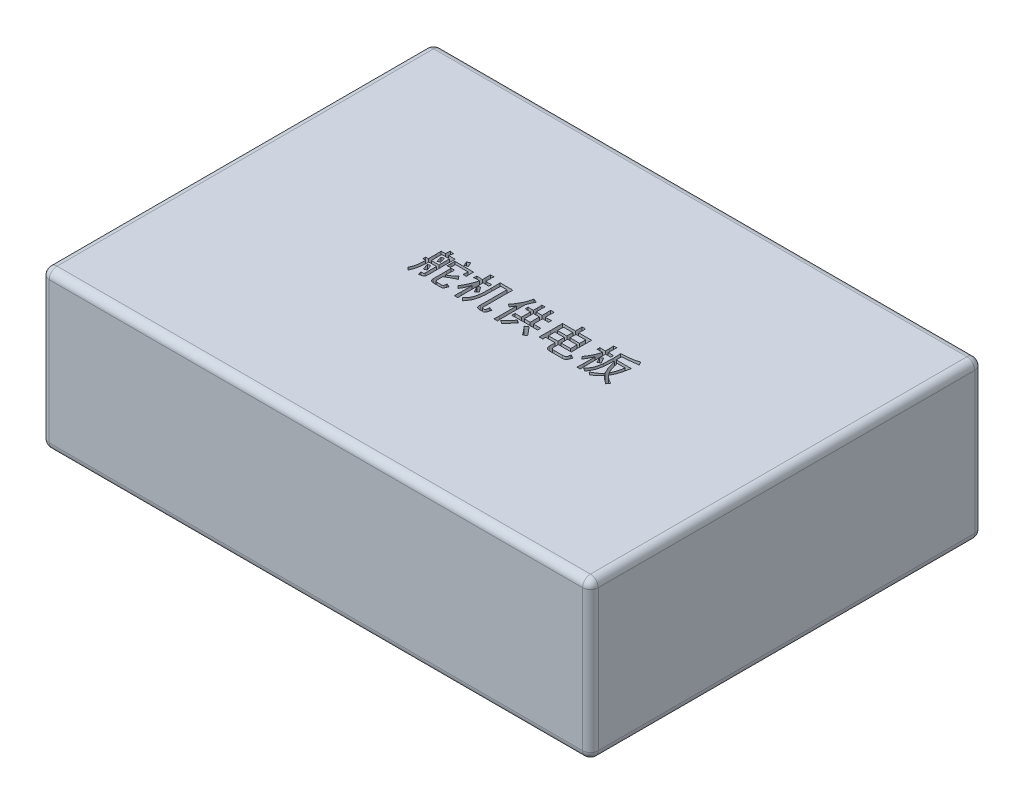
from build123d import *

# Parameters (mm, degrees)
SKETCH_1_W          = 70
SKETCH_1_H          = 50
EXTRUDE_1_DEPTH     = 20
SKETCH_2_W          = 0.982456141
SKETCH_2_H          = 1.330409356
SKETCH_2_W_2        = 0.757309941
SKETCH_2_H_2        = 1.166666667
SKETCH_2_W_3        = 1.228070175
SKETCH_2_H_3        = 0.81871345
SKETCH_2_W_4        = 1.187134503
SKETCH_2_H_4        = 0.757309942
CUT_EXTRUDE_1_DEPTH = 2
FILLET_1_R          = 1


with BuildPart() as part:
    # 草图1 → 凸台-拉伸1 (new body)
    with BuildSketch(Plane(origin=(0, 0, 0), x_dir=(1, 0, 0), z_dir=(0, 1, 0))):
        Rectangle(SKETCH_1_W, SKETCH_1_H)
    extrude(amount=EXTRUDE_1_DEPTH)

    # 草图2 → 切除-拉伸1 (cut)
    # profile 1 of 15: a face of its own
    with BuildSketch(Plane(origin=(0, 20, 0), x_dir=(1, 0, 0), z_dir=(0, 1, 0))):
        with BuildLine():
            add(Edge.make_bspline(
                [(-10.091180796, 2.630830383), (-10.116509023, 2.549352299), (-10.166692378, 2.387918032), (-10.198322063, 2.221852365), (-10.213987814, 2.139602312)],
                knots=[0, 0, 0, 0, 1.009427368, 2, 2, 2, 2], degree=3))
            Line((-10.213987814, 2.139602312), (-9.374806527, 2.139602312))
            add(Edge.make_bspline(
                [(-9.374806527, 2.139602312), (-9.380681528, 2.023642055), (-9.392426642, 1.791817995), (-9.394325386, 1.559704393), (-9.395274364, 1.44369588)],
                knots=[0, 0, 0, 0, 1.000416063, 2, 2, 2, 2], degree=3))
            Line((-9.395274364, 1.44369588), (-9.395274364, -1.319462015))
            add(Edge.make_bspline(
                [(-9.395274364, -1.319462015), (-9.395479753, -1.343981891), (-9.395869913, -1.390560204), (-9.40106531, -1.456943952), (-9.410225057, -1.516170953), (-9.421782985, -1.568645944), (-9.437633649, -1.614078202), (-9.457400929, -1.652294079), (-9.480116935, -1.684313908), (-9.508299614, -1.710099406), (-9.543709064, -1.730557479), (-9.58670202, -1.751289052), (-9.639876589, -1.771228245), (-9.702886829, -1.791591983), (-9.775763303, -1.81189328), (-9.858455241, -1.832231036), (-9.950971765, -1.852678427), (-10.016102366, -1.8654162), (-10.050245124, -1.872093594)],
                knots=[0, 0, 0, 0, 1.192261739, 2.264837708, 3.234637038, 4.105058576, 4.874652043, 5.567196767, 6.19150862, 6.774285489, 7.408675279, 8.172655873, 9.094639486, 10.167215454, 11.392706019, 12.772661644, 14.308164957, 16, 16, 16, 16], degree=3))
            add(Edge.make_bspline(
                [(-10.050245124, -1.872093594), (-10.055131622, -1.839607602), (-10.065558579, -1.770288021), (-10.096814916, -1.662915484), (-10.138255675, -1.544606997), (-10.174419878, -1.464244562), (-10.193519978, -1.421801196)],
                knots=[0, 0, 0, 0, 0.83028686, 1.771690953, 2.823120079, 4, 4, 4, 4], degree=3))
            add(Edge.make_bspline(
                [(-10.193519978, -1.421801196), (-10.158664261, -1.42475731), (-10.094814571, -1.430172403), (-10.00708365, -1.435158972), (-9.936271876, -1.435757895), (-9.886953088, -1.434861707), (-9.854739953, -1.428468179), (-9.835196569, -1.416922045), (-9.819643454, -1.39959768), (-9.805247005, -1.378008106), (-9.796058442, -1.350028676), (-9.789543067, -1.317183396), (-9.784832653, -1.279159066), (-9.784395446, -1.252009408), (-9.784163252, -1.23759067)],
                knots=[0, 0, 0, 0, 2.276838966, 4.170778201, 5.716852393, 6.886417439, 7.377068686, 7.834037491, 8.334243345, 8.881697534, 9.511198957, 10.233730078, 11.061963073, 12, 12, 12, 12], degree=3))
            Line((-9.784163252, -1.23759067), (-9.784163252, 0.154222195))
            Line((-9.784163252, 0.154222195), (-10.766619393, 0.154222195))
            add(Edge.make_bspline(
                [(-10.766619393, 0.154222195), (-10.767019743, 0.088263387), (-10.767832972, -0.045718421), (-10.775827461, -0.249951662), (-10.788741901, -0.460490758), (-10.806531583, -0.67438661), (-10.829642388, -0.884955943), (-10.861320009, -1.086169058), (-10.901420861, -1.2743355), (-10.948130439, -1.450330815), (-11.002588488, -1.613353143), (-11.060176936, -1.765468456), (-11.124760099, -1.905561286), (-11.172949821, -1.993139109), (-11.196443954, -2.035836284)],
                knots=[0, 0, 0, 0, 1.052188393, 2.137305159, 3.26004622, 4.416994961, 5.561062578, 6.638658199, 7.664889657, 8.629032334, 9.541755406, 10.405664026, 11.222706841, 12, 12, 12, 12], degree=3))
            add(Edge.make_bspline(
                [(-11.196443954, -2.035836284), (-11.22332655, -2.006374746), (-11.275405761, -1.94929939), (-11.35790899, -1.872801613), (-11.439230857, -1.805108333), (-11.496287186, -1.767504534), (-11.523929334, -1.749286576)],
                knots=[0, 0, 0, 0, 1.095833255, 2.12293979, 3.090618405, 4, 4, 4, 4], degree=3))
            add(Edge.make_bspline(
                [(-11.523929334, -1.749286576), (-11.506526676, -1.719976149), (-11.469667896, -1.657896751), (-11.421395833, -1.554230657), (-11.373497004, -1.437137881), (-11.327890814, -1.306543369), (-11.284163698, -1.16407575), (-11.248571312, -1.009930677), (-11.217977492, -0.846094963), (-11.194961507, -0.671176875), (-11.176800039, -0.484330216), (-11.164192076, -0.283833589), (-11.156546171, -0.069468769), (-11.155861216, 0.078155964), (-11.155508282, 0.154222195)],
                knots=[0, 0, 0, 0, 0.625143458, 1.324052022, 2.095539542, 2.946088223, 3.861405889, 4.828605592, 5.84715547, 6.91863876, 8.064676218, 9.291293629, 10.604291555, 12, 12, 12, 12], degree=3))
            add(Edge.make_bspline(
                [(-11.155508282, 0.154222195), (-11.21190011, 0.153178998), (-11.328155616, 0.151028378), (-11.443874265, 0.139625874), (-11.503461498, 0.133754359)],
                knots=[0, 0, 0, 0, 0.970136036, 2, 2, 2, 2], degree=3))
            Line((-11.503461498, 0.133754359), (-11.503461498, 0.502175412))
            add(Edge.make_bspline(
                [(-11.503461498, 0.502175412), (-11.470628035, 0.498945323), (-11.40754807, 0.492739647), (-11.316769592, 0.48697766), (-11.233626296, 0.482827143), (-11.180781602, 0.482069787), (-11.155508282, 0.481707576)],
                knots=[0, 0, 0, 0, 1.135354998, 2.181254894, 3.13017326, 4, 4, 4, 4], degree=3))
            Line((-11.155508282, 0.481707576), (-11.155508282, 1.44369588))
            add(Edge.make_bspline(
                [(-11.155508282, 1.44369588), (-11.155859124, 1.499037036), (-11.156573698, 1.611752463), (-11.160584189, 1.783085075), (-11.166344382, 1.959753938), (-11.172728773, 2.078966342), (-11.175976118, 2.139602312)],
                knots=[0, 0, 0, 0, 0.953766709, 1.942572767, 2.953514133, 4, 4, 4, 4], degree=3))
            Line((-11.175976118, 2.139602312), (-10.623344539, 2.139602312))
            add(Edge.make_bspline(
                [(-10.623344539, 2.139602312), (-10.616984165, 2.194911724), (-10.604828979, 2.300612464), (-10.592140638, 2.451531732), (-10.583777468, 2.587272269), (-10.582847371, 2.672513665), (-10.582408866, 2.712701728)],
                knots=[0, 0, 0, 0, 1.162068518, 2.220806553, 3.161178245, 4, 4, 4, 4], degree=3))
            add(Edge.make_bspline(
                [(-10.582408866, 2.712701728), (-10.503863601, 2.698810179), (-10.340391549, 2.669898445), (-10.176385174, 2.644187631), (-10.091180796, 2.630830383)],
                knots=[0, 0, 0, 0, 0.960962616, 2, 2, 2, 2], degree=3))
        make_face()
        with Locations((-10.275391323, 1.146912254)):
            Rectangle(SKETCH_2_W, SKETCH_2_H, mode=Mode.SUBTRACT)
    # profile 2 of 15: a face of its own
    with BuildSketch(Plane(origin=(0, 20, 0), x_dir=(1, 0, 0), z_dir=(0, 1, 0))):
        with BuildLine():
            add(Edge.make_bspline(
                [(-8.228607697, 0.891064301), (-8.231917167, 0.85065128), (-8.239025453, 0.763849665), (-8.244272681, 0.624259733), (-8.248194616, 0.46682197), (-8.248771838, 0.355871683), (-8.249075533, 0.297497049)],
                knots=[0, 0, 0, 0, 0.818941013, 1.75897278, 2.820921107, 4, 4, 4, 4], degree=3))
            Line((-8.249075533, 0.297497049), (-8.249075533, -0.214198857))
            add(Edge.make_bspline(
                [(-8.249075533, -0.214198857), (-8.218746193, -0.19525777), (-8.152203216, -0.153700772), (-8.043422784, -0.085417265), (-7.917484958, -0.004520357), (-7.77580411, 0.082002386), (-7.633490784, 0.17960547), (-7.502050855, 0.286139806), (-7.385801306, 0.399570517), (-7.319662123, 0.482030184), (-7.287087229, 0.522643248)],
                knots=[0, 0, 0, 0, 0.703761305, 1.544061709, 2.527769921, 3.64957381, 4.811151978, 5.921086586, 6.976092829, 8, 8, 8, 8], degree=3))
            add(Edge.make_bspline(
                [(-7.287087229, 0.522643248), (-7.270303167, 0.499538411), (-7.237861087, 0.454878842), (-7.188498806, 0.391980211), (-7.140732338, 0.334578006), (-7.093515306, 0.283663852), (-7.049497593, 0.2363137), (-7.004209294, 0.197685133), (-6.961921328, 0.162572404), (-6.932734553, 0.143127188), (-6.918666176, 0.133754359)],
                knots=[0, 0, 0, 0, 1.272217522, 2.459081969, 3.561803314, 4.597795188, 5.553211128, 6.438603501, 7.247388064, 8, 8, 8, 8], degree=3))
            add(Edge.make_bspline(
                [(-6.918666176, 0.133754359), (-6.970914094, 0.112209943), (-7.077830176, 0.068123121), (-7.23847068, -0.008151319), (-7.405546937, -0.090630269), (-7.631342171, -0.21568643), (-7.91298411, -0.37391321), (-8.138129969, -0.500013424), (-8.249075533, -0.562152074)],
                knots=[0, 0, 0, 0, 0.676918704, 1.385193893, 2.129767239, 2.908655563, 4.476672163, 6, 6, 6, 6], degree=3))
            Line((-8.249075533, -0.562152074), (-8.249075533, -1.278526343))
            add(Edge.make_bspline(
                [(-8.249075533, -1.278526343), (-8.248378114, -1.301115074), (-8.247070057, -1.343481791), (-8.23288962, -1.402377481), (-8.211521481, -1.453393488), (-8.178326705, -1.494327222), (-8.137392971, -1.527521998), (-8.086376963, -1.548890137), (-8.027481274, -1.563070574), (-7.985114557, -1.564378631), (-7.962525826, -1.56507605)],
                knots=[0, 0, 0, 0, 1.16564209, 2.186241843, 3.116327902, 4, 4.883672098, 5.813758157, 6.83435791, 8, 8, 8, 8], degree=3))
            Line((-7.962525826, -1.56507605), (-7.471297755, -1.56507605))
            add(Edge.make_bspline(
                [(-7.471297755, -1.56507605), (-7.455120435, -1.564779603), (-7.424211372, -1.5642132), (-7.380448679, -1.560164108), (-7.341908018, -1.551567531), (-7.308356584, -1.540594768), (-7.279787318, -1.525928503), (-7.255816224, -1.508872881), (-7.237558092, -1.48740853), (-7.219558068, -1.45194092), (-7.204517914, -1.395153805), (-7.187991011, -1.313152431), (-7.173897498, -1.210592239), (-7.167669012, -1.135287624), (-7.164280211, -1.094315816)],
                knots=[0, 0, 0, 0, 0.887338487, 1.695385909, 2.404850787, 3.0490568, 3.625452115, 4.160374195, 4.651890253, 5.154035959, 6.328773904, 7.856163338, 9.745417366, 12, 12, 12, 12], degree=3))
            add(Edge.make_bspline(
                [(-7.164280211, -1.094315816), (-7.12991513, -1.113996451), (-7.061599796, -1.153120151), (-6.955196145, -1.203066593), (-6.846175042, -1.245165786), (-6.771761402, -1.267386462), (-6.73445565, -1.278526343)],
                knots=[0, 0, 0, 0, 1.0129089, 2.013590745, 3.004154468, 4, 4, 4, 4], degree=3))
            add(Edge.make_bspline(
                [(-6.73445565, -1.278526343), (-6.742952182, -1.304838148), (-6.759331547, -1.355561275), (-6.784509962, -1.428284784), (-6.808251309, -1.495410021), (-6.833562096, -1.555781397), (-6.857721822, -1.610419875), (-6.880986402, -1.659242482), (-6.904566602, -1.701729175), (-6.927952522, -1.739366116), (-6.955365247, -1.771720468), (-6.988586558, -1.799710683), (-7.029225742, -1.822016926), (-7.076211422, -1.840202783), (-7.129621905, -1.854359319), (-7.189694112, -1.864966215), (-7.256653628, -1.870712171), (-7.303501779, -1.871618963), (-7.328022902, -1.872093594)],
                knots=[0, 0, 0, 0, 1.415512607, 2.728783703, 3.940164426, 5.059711355, 6.079021254, 6.998998031, 7.827061012, 8.566278071, 9.263672048, 9.989177554, 10.777055247, 11.625088856, 12.563438166, 13.60137791, 14.744520196, 16, 16, 16, 16], degree=3))
            Line((-7.328022902, -1.872093594), (-8.064865007, -1.872093594))
            add(Edge.make_bspline(
                [(-8.064865007, -1.872093594), (-8.088119716, -1.871546913), (-8.132921036, -1.870493706), (-8.198079927, -1.86552965), (-8.258645293, -1.855684399), (-8.314782531, -1.841870058), (-8.366912679, -1.825691015), (-8.414054302, -1.804219262), (-8.456842976, -1.779200755), (-8.495133275, -1.750279236), (-8.528663969, -1.717160553), (-8.558646376, -1.681008083), (-8.582906357, -1.639815369), (-8.603523447, -1.595525679), (-8.618359376, -1.54693082), (-8.629981741, -1.495036001), (-8.636696379, -1.439158807), (-8.637535305, -1.400592505), (-8.637964422, -1.380865524)],
                knots=[0, 0, 0, 0, 1.291522954, 2.4881813, 3.625371627, 4.693928206, 5.696715841, 6.651225222, 7.563229515, 8.444383844, 9.307593854, 10.175353091, 11.044019316, 11.954403226, 12.88181915, 13.858853017, 14.904785677, 16, 16, 16, 16], degree=3))
            Line((-8.637964422, -1.380865524), (-8.637964422, 0.297497049))
            add(Edge.make_bspline(
                [(-8.637964422, 0.297497049), (-8.638268117, 0.355871683), (-8.638845339, 0.46682197), (-8.642767274, 0.624259733), (-8.648014502, 0.763849665), (-8.655122788, 0.85065128), (-8.658432258, 0.891064301)],
                knots=[0, 0, 0, 0, 1.179078893, 2.24102722, 3.181058987, 4, 4, 4, 4], degree=3))
            Line((-8.658432258, 0.891064301), (-8.228607697, 0.891064301))
        make_face()
    # profile 3 of 15: a face of its own
    with BuildSketch(Plane(origin=(0, 20, 0), x_dir=(1, 0, 0), z_dir=(0, 1, 0))):
        with BuildLine():
            add(Edge.make_bspline(
                [(-6.775391323, 1.893988277), (-6.778689849, 1.861665026), (-6.78563748, 1.793583105), (-6.790990925, 1.686071133), (-6.794956822, 1.568301789), (-6.795549882, 1.48640464), (-6.795859159, 1.44369588)],
                knots=[0, 0, 0, 0, 0.864453382, 1.820783642, 2.863554693, 4, 4, 4, 4], degree=3))
            add(Edge.make_bspline(
                [(-6.795859159, 1.44369588), (-6.794908785, 1.361790446), (-6.793006449, 1.197842827), (-6.781266296, 1.034304952), (-6.775391323, 0.95246781)],
                knots=[0, 0, 0, 0, 0.999165878, 2, 2, 2, 2], degree=3))
            Line((-6.775391323, 0.95246781), (-7.184748048, 0.95246781))
            Line((-7.184748048, 0.95246781), (-7.184748048, 1.566502897))
            Line((-7.184748048, 1.566502897), (-8.781239276, 1.566502897))
            Line((-8.781239276, 1.566502897), (-8.781239276, 0.911532137))
            Line((-8.781239276, 0.911532137), (-9.190596001, 0.911532137))
            add(Edge.make_bspline(
                [(-9.190596001, 0.911532137), (-9.187355769, 0.958015024), (-9.18105467, 1.048407709), (-9.17532016, 1.18010744), (-9.171211568, 1.304186129), (-9.170482351, 1.384310833), (-9.170128165, 1.423228043)],
                knots=[0, 0, 0, 0, 1.091612352, 2.122797789, 3.088227845, 4, 4, 4, 4], degree=3))
            add(Edge.make_bspline(
                [(-9.170128165, 1.423228043), (-9.171006808, 1.503369655), (-9.172729677, 1.660513688), (-9.184720404, 1.817206809), (-9.190596001, 1.893988277)],
                knots=[0, 0, 0, 0, 1.019976524, 2, 2, 2, 2], degree=3))
            Line((-9.190596001, 1.893988277), (-6.775391323, 1.893988277))
        make_face()
    # profile 4 of 15: a face of its own
    with BuildSketch(Plane(origin=(0, 20, 0), x_dir=(1, 0, 0), z_dir=(0, 1, 0))):
        with BuildLine():
            add(Edge.make_bspline(
                [(-10.254923486, -0.09139184), (-10.244504666, -0.114613305), (-10.222825976, -0.162930766), (-10.190137652, -0.238962212), (-10.156286993, -0.321452924), (-10.120360038, -0.410188787), (-10.084165955, -0.505544334), (-10.047252283, -0.607649971), (-10.00754089, -0.715516378), (-9.981647071, -0.790035233), (-9.968373779, -0.828233945)],
                knots=[0, 0, 0, 0, 0.77234433, 1.607035437, 2.511280298, 3.4781238, 4.512031754, 5.606093479, 6.772872395, 8, 8, 8, 8], degree=3))
            add(Edge.make_bspline(
                [(-9.968373779, -0.828233945), (-10.001880499, -0.838923199), (-10.067584144, -0.85988386), (-10.162567583, -0.898365736), (-10.252402242, -0.941677552), (-10.308971826, -0.975393761), (-10.336794831, -0.991976635)],
                knots=[0, 0, 0, 0, 1.043514634, 2.046237781, 3.039067756, 4, 4, 4, 4], degree=3))
            add(Edge.make_bspline(
                [(-10.336794831, -0.991976635), (-10.349877882, -0.944708249), (-10.374951118, -0.854119944), (-10.411687964, -0.724867498), (-10.447071042, -0.608602242), (-10.478384891, -0.504752921), (-10.508145002, -0.413915192), (-10.53443315, -0.335657557), (-10.55828917, -0.270252266), (-10.57493217, -0.231574462), (-10.582408866, -0.214198857)],
                knots=[0, 0, 0, 0, 1.442275883, 2.764074223, 3.951252972, 5.016031887, 5.953633639, 6.761982854, 7.443833545, 8, 8, 8, 8], degree=3))
            add(Edge.make_bspline(
                [(-10.582408866, -0.214198857), (-10.531295646, -0.193245327), (-10.423377109, -0.14900483), (-10.313015021, -0.111259783), (-10.254923486, -0.09139184)],
                knots=[0, 0, 0, 0, 0.947255614, 2, 2, 2, 2], degree=3))
        make_face()
    # profile 5 of 15: a face of its own
    with BuildSketch(Plane(origin=(0, 20, 0), x_dir=(1, 0, 0), z_dir=(0, 1, 0))):
        with BuildLine():
            add(Edge.make_bspline(
                [(-10.173052141, 1.546035061), (-10.167439375, 1.527604599), (-10.155233489, 1.487524516), (-10.136799279, 1.422608419), (-10.114533277, 1.349234037), (-10.090087603, 1.266911284), (-10.063913072, 1.175259551), (-10.034166268, 1.074816041), (-10.002461977, 0.965288186), (-9.980038718, 0.889536085), (-9.968373779, 0.850128628)],
                knots=[0, 0, 0, 0, 0.637425231, 1.386186456, 2.232616404, 3.174344816, 4.227428328, 5.386186395, 6.640252261, 8, 8, 8, 8], degree=3))
            add(Edge.make_bspline(
                [(-9.968373779, 0.850128628), (-10.0017956, 0.843082008), (-10.066886994, 0.829358211), (-10.161534463, 0.804456349), (-10.251460547, 0.77891057), (-10.30885575, 0.757978735), (-10.336794831, 0.747789447)],
                knots=[0, 0, 0, 0, 1.070685613, 2.085237009, 3.067923516, 4, 4, 4, 4], degree=3))
            add(Edge.make_bspline(
                [(-10.336794831, 0.747789447), (-10.340800737, 0.76927468), (-10.349248288, 0.814582193), (-10.363328767, 0.885779485), (-10.381780928, 0.963334661), (-10.40397155, 1.046798082), (-10.428160207, 1.137173261), (-10.456308612, 1.233611068), (-10.487317448, 1.336735546), (-10.509552832, 1.407333696), (-10.521005358, 1.44369588)],
                knots=[0, 0, 0, 0, 0.728114426, 1.535429203, 2.417535613, 3.383321271, 4.412548703, 5.534194375, 6.729965619, 8, 8, 8, 8], degree=3))
            add(Edge.make_bspline(
                [(-10.521005358, 1.44369588), (-10.464509259, 1.458611105), (-10.34757365, 1.489482634), (-10.232519301, 1.52676516), (-10.173052141, 1.546035061)],
                knots=[0, 0, 0, 0, 0.96627706, 2, 2, 2, 2], degree=3))
        make_face()
    # profile 6 of 15: a face of its own
    with BuildSketch(Plane(origin=(0, 20, 0), x_dir=(1, 0, 0), z_dir=(0, 1, 0))):
        with BuildLine():
            add(Edge.make_bspline(
                [(-7.757847463, 2.180537985), (-7.791561964, 2.169732812), (-7.85879714, 2.148184585), (-7.957721854, 2.110264029), (-8.053763863, 2.066382685), (-8.11581711, 2.033286243), (-8.146736352, 2.016795295)],
                knots=[0, 0, 0, 0, 1.004863865, 2.003950758, 3.005429506, 4, 4, 4, 4], degree=3))
            add(Edge.make_bspline(
                [(-8.146736352, 2.016795295), (-8.158727772, 2.05407967), (-8.184831875, 2.135243962), (-8.236250042, 2.263876097), (-8.297994906, 2.411390658), (-8.346210673, 2.514518014), (-8.371882551, 2.569426874)],
                knots=[0, 0, 0, 0, 0.786782388, 1.712745222, 2.782180038, 4, 4, 4, 4], degree=3))
            add(Edge.make_bspline(
                [(-8.371882551, 2.569426874), (-8.314012261, 2.597274567), (-8.192861589, 2.655573338), (-8.068446813, 2.70654542), (-8.003461498, 2.733169564)],
                knots=[0, 0, 0, 0, 0.9553441, 2, 2, 2, 2], degree=3))
            add(Edge.make_bspline(
                [(-8.003461498, 2.733169564), (-7.982642767, 2.693671657), (-7.93920628, 2.611262683), (-7.878579966, 2.479122741), (-7.816636678, 2.334729259), (-7.777944142, 2.233247187), (-7.757847463, 2.180537985)],
                knots=[0, 0, 0, 0, 0.885139078, 1.846766319, 2.881622853, 4, 4, 4, 4], degree=3))
        make_face()
    # profile 7 of 15: a face of its own
    with BuildSketch(Plane(origin=(0, 20, 0), x_dir=(1, 0, 0), z_dir=(0, 1, 0))):
        with BuildLine():
            add(Edge.make_bspline(
                [(-2.292935182, 2.405684184), (-2.29616823, 2.31371112), (-2.302402603, 2.136356963), (-2.308160777, 1.880612304), (-2.312279928, 1.645102251), (-2.313039754, 1.494993343), (-2.313403018, 1.423228043)],
                knots=[0, 0, 0, 0, 1.123772506, 2.167001044, 3.123664804, 4, 4, 4, 4], degree=3))
            Line((-2.313403018, 1.423228043), (-2.313403018, -1.23759067))
            add(Edge.make_bspline(
                [(-2.313403018, -1.23759067), (-2.312877891, -1.258573306), (-2.311895381, -1.297831634), (-2.307047175, -1.353201573), (-2.297570515, -1.400860658), (-2.283826656, -1.440767213), (-2.267579407, -1.473885169), (-2.245866916, -1.498852215), (-2.220046695, -1.516609764), (-2.18108347, -1.527331307), (-2.133370105, -1.532328472), (-2.079513474, -1.537717045), (-2.030861635, -1.53809161), (-1.986885925, -1.536787407), (-1.945831458, -1.524415054), (-1.913105727, -1.492843282), (-1.888725138, -1.44729911), (-1.871331863, -1.386797417), (-1.858452551, -1.31127827), (-1.848800326, -1.219614488), (-1.844174126, -1.111292706), (-1.843177936, -1.033673545), (-1.842642785, -0.991976635)],
                knots=[0, 0, 0, 0, 1.107162847, 2.071491955, 2.92901372, 3.66256055, 4.29460564, 4.861430803, 5.390136841, 5.921357747, 6.971433914, 7.921280553, 8.774543508, 9.536256742, 10.240259185, 10.976465991, 11.86602806, 12.941189201, 14.282555604, 15.90484167, 17.800086396, 20, 20, 20, 20], degree=3))
            add(Edge.make_bspline(
                [(-1.842642785, -0.991976635), (-1.810783308, -1.008638962), (-1.745888848, -1.0425784), (-1.641697195, -1.085368993), (-1.530489517, -1.124416164), (-1.452648913, -1.145123483), (-1.412818223, -1.155719325)],
                knots=[0, 0, 0, 0, 0.935128543, 1.904760128, 2.927875106, 4, 4, 4, 4], degree=3))
            add(Edge.make_bspline(
                [(-1.412818223, -1.155719325), (-1.419507783, -1.190112158), (-1.432320066, -1.255983572), (-1.452790169, -1.350004818), (-1.473115188, -1.434970151), (-1.493620592, -1.511051597), (-1.513819103, -1.578397602), (-1.534128894, -1.636895495), (-1.554395715, -1.686394287), (-1.580763874, -1.7391743), (-1.619846062, -1.793899001), (-1.683123214, -1.840003723), (-1.759152111, -1.867562423), (-1.813844977, -1.870530691), (-1.842642785, -1.872093594)],
                knots=[0, 0, 0, 0, 1.377774292, 2.638803852, 3.783603402, 4.812862051, 5.73703437, 6.54784008, 7.247235692, 7.838285142, 8.867735638, 9.855481803, 10.870832218, 12, 12, 12, 12], degree=3))
            Line((-1.842642785, -1.872093594), (-2.272467346, -1.872093594))
            add(Edge.make_bspline(
                [(-2.272467346, -1.872093594), (-2.310744681, -1.871074895), (-2.382424679, -1.86916723), (-2.482004835, -1.847786954), (-2.565936905, -1.813660177), (-2.623416745, -1.771166822), (-2.658660295, -1.727625596), (-2.680455824, -1.687810142), (-2.6978871, -1.640505492), (-2.710918241, -1.586263049), (-2.721031028, -1.524726805), (-2.725884204, -1.456003461), (-2.726448547, -1.379819803), (-2.724028012, -1.326783289), (-2.722759744, -1.298994179)],
                knots=[0, 0, 0, 0, 1.588052086, 2.973863537, 4.206237065, 5.329601047, 5.896896337, 6.521962331, 7.206365823, 7.985504418, 8.836382591, 9.79454748, 10.844427004, 12, 12, 12, 12], degree=3))
            Line((-2.722759744, -1.298994179), (-2.722759744, 2.057730967))
            Line((-2.722759744, 2.057730967), (-3.500537521, 2.057730967))
            add(Edge.make_bspline(
                [(-3.500537521, 2.057730967), (-3.500732159, 1.963224981), (-3.501109986, 1.779771067), (-3.502615551, 1.512676559), (-3.504940175, 1.261755686), (-3.507640336, 1.026994868), (-3.512378266, 0.808674173), (-3.517656557, 0.60677322), (-3.523459003, 0.42101956), (-3.533305844, 0.197498195), (-3.550756727, -0.064462551), (-3.589412047, -0.364180246), (-3.643565183, -0.648602504), (-3.699938442, -0.876609695), (-3.758361478, -1.05259697), (-3.809404097, -1.184302317), (-3.872437436, -1.314969559), (-3.9427965, -1.446938752), (-4.023813469, -1.578345729), (-4.112121192, -1.711728477), (-4.211723989, -1.843874179), (-4.283046431, -1.930473446), (-4.319250972, -1.974432775)],
                knots=[0, 0, 0, 0, 1.3440624, 2.609078204, 3.79865397, 4.912805143, 5.94802595, 6.904290907, 7.785225706, 8.591024543, 10.086317096, 11.5176263, 12.88568882, 14.202713716, 14.853894477, 15.521914004, 16.209933969, 16.915790003, 17.647995705, 18.404509329, 19.190100542, 20, 20, 20, 20], degree=3))
            add(Edge.make_bspline(
                [(-4.319250972, -1.974432775), (-4.328516802, -1.963744659), (-4.348320163, -1.940901521), (-4.38165588, -1.906192402), (-4.420361365, -1.869313895), (-4.463883797, -1.829687808), (-4.512241077, -1.787280401), (-4.566113854, -1.742578901), (-4.625406377, -1.695836422), (-4.66644064, -1.66361761), (-4.687672024, -1.646947395)],
                knots=[0, 0, 0, 0, 0.687493041, 1.469341937, 2.338022197, 3.285689836, 4.330211177, 5.464069714, 6.687893791, 8, 8, 8, 8], degree=3))
            add(Edge.make_bspline(
                [(-4.687672024, -1.646947395), (-4.641248093, -1.608284734), (-4.548748193, -1.531249202), (-4.426917892, -1.397800768), (-4.317997864, -1.252848608), (-4.225321521, -1.095392519), (-4.145561913, -0.931122621), (-4.079222048, -0.763137568), (-4.027348892, -0.59249007), (-3.989814311, -0.4185679), (-3.962996946, -0.240798201), (-3.938722134, -0.059187295), (-3.92207262, 0.12776663), (-3.910808343, 0.287286705), (-3.905372822, 0.420305035), (-3.900211945, 0.527153647), (-3.897865711, 0.640653103), (-3.894466071, 0.760411612), (-3.892249212, 0.886257325), (-3.89104353, 1.018420239), (-3.888989985, 1.157140998), (-3.889278629, 1.251903856), (-3.88942641, 1.300421026)],
                knots=[0, 0, 0, 0, 1.143458675, 2.278346721, 3.413911091, 4.573204686, 5.733683855, 6.870720614, 7.991413809, 9.108871136, 10.238303566, 11.396815996, 12.579643745, 13.793578059, 14.426162601, 15.10179181, 15.820151701, 16.576797582, 17.371629784, 18.204686157, 19.0808261, 20, 20, 20, 20], degree=3))
            add(Edge.make_bspline(
                [(-3.88942641, 1.300421026), (-3.889748871, 1.400234902), (-3.890377488, 1.594815996), (-3.89433956, 1.878845793), (-3.899848619, 2.147494141), (-3.90661079, 2.321293661), (-3.909894247, 2.405684184)],
                knots=[0, 0, 0, 0, 1.083434328, 2.112089461, 3.08330151, 4, 4, 4, 4], degree=3))
            Line((-3.909894247, 2.405684184), (-2.292935182, 2.405684184))
        make_face()
    # profile 8 of 15: a face of its own
    with BuildSketch(Plane(origin=(0, 20, 0), x_dir=(1, 0, 0), z_dir=(0, 1, 0))):
        with BuildLine():
            add(Edge.make_bspline(
                [(-4.708139861, 0.727321611), (-4.681570394, 0.690961419), (-4.630009625, 0.620400745), (-4.555644072, 0.517353309), (-4.487148755, 0.420477156), (-4.422779844, 0.330577592), (-4.364101986, 0.246795956), (-4.309986425, 0.16942075), (-4.261644953, 0.098290565), (-4.231290081, 0.052910501), (-4.21691179, 0.031415178)],
                knots=[0, 0, 0, 0, 1.268728166, 2.462096906, 3.580149047, 4.611304729, 5.577109638, 6.461849213, 7.271419099, 8, 8, 8, 8], degree=3))
            add(Edge.make_bspline(
                [(-4.21691179, 0.031415178), (-4.242082484, 0.010322671), (-4.294144549, -0.033304233), (-4.377105021, -0.098797536), (-4.468257566, -0.165986685), (-4.531945932, -0.211263917), (-4.564865007, -0.234666693)],
                knots=[0, 0, 0, 0, 0.899295784, 1.860067729, 2.893917446, 4, 4, 4, 4], degree=3))
            add(Edge.make_bspline(
                [(-4.564865007, -0.234666693), (-4.575805334, -0.211331792), (-4.598742188, -0.162409196), (-4.638430354, -0.087426682), (-4.684463637, -0.006999057), (-4.734898845, 0.079888488), (-4.790894609, 0.172782057), (-4.854347023, 0.270186097), (-4.922415398, 0.374146941), (-4.97010323, 0.445117434), (-4.994689568, 0.481707576)],
                knots=[0, 0, 0, 0, 0.739552579, 1.55050287, 2.433808093, 3.398993409, 4.433757318, 5.546163387, 6.734879468, 8, 8, 8, 8], degree=3))
            Line((-4.994689568, 0.481707576), (-4.994689568, -1.012444471))
            add(Edge.make_bspline(
                [(-4.994689568, -1.012444471), (-4.994332024, -1.082693742), (-4.993593742, -1.227749533), (-4.989535004, -1.45163781), (-4.98377515, -1.688434721), (-4.977462365, -1.85036902), (-4.974221732, -1.933497103)],
                knots=[0, 0, 0, 0, 0.914970831, 1.889298144, 2.91648281, 4, 4, 4, 4], degree=3))
            Line((-4.974221732, -1.933497103), (-5.42451413, -1.933497103))
            add(Edge.make_bspline(
                [(-5.42451413, -1.933497103), (-5.421273496, -1.85036902), (-5.414960711, -1.688434721), (-5.409200857, -1.45163781), (-5.40514212, -1.227749533), (-5.404403837, -1.082693742), (-5.404046293, -1.012444471)],
                knots=[0, 0, 0, 0, 1.08351719, 2.110701856, 3.085029169, 4, 4, 4, 4], degree=3))
            Line((-5.404046293, -1.012444471), (-5.404046293, 0.297497049))
            add(Edge.make_bspline(
                [(-5.404046293, 0.297497049), (-5.439010637, 0.197346303), (-5.507774992, 0.000379885), (-5.607195143, -0.241298323), (-5.697372504, -0.433698364), (-5.779141471, -0.584631897), (-5.872577153, -0.745241636), (-5.941390841, -0.853733869), (-5.977145709, -0.91010529)],
                knots=[0, 0, 0, 0, 1.423898173, 2.800379755, 3.505978649, 4.275424401, 5.103928691, 6, 6, 6, 6], degree=3))
            add(Edge.make_bspline(
                [(-5.977145709, -0.91010529), (-6.006826961, -0.877635143), (-6.063758123, -0.815354648), (-6.14768586, -0.727897055), (-6.227246727, -0.651179903), (-6.279717721, -0.604692332), (-6.304631089, -0.58261991)],
                knots=[0, 0, 0, 0, 1.139109604, 2.184908859, 3.138189897, 4, 4, 4, 4], degree=3))
            add(Edge.make_bspline(
                [(-6.304631089, -0.58261991), (-6.290268556, -0.565604144), (-6.259339774, -0.528961797), (-6.214136541, -0.466009227), (-6.165032922, -0.392730614), (-6.112905504, -0.308411714), (-6.057450231, -0.213427529), (-5.999333736, -0.107371662), (-5.938216725, 0.009665447), (-5.849914681, 0.18011819), (-5.745621633, 0.40900733), (-5.63492477, 0.698441484), (-5.540513551, 1.003750483), (-5.490764682, 1.213935505), (-5.465449802, 1.320888862)],
                knots=[0, 0, 0, 0, 0.382324869, 0.823311766, 1.330084607, 1.89733009, 2.525583938, 3.219039426, 3.974232691, 4.793354794, 6.516037834, 8.290929161, 10.112626788, 12, 12, 12, 12], degree=3))
            Line((-5.465449802, 1.320888862), (-5.58825682, 1.320888862))
            add(Edge.make_bspline(
                [(-5.58825682, 1.320888862), (-5.683898264, 1.319354532), (-5.875685264, 1.316277785), (-6.06596586, 1.292082587), (-6.161356235, 1.27995319)],
                knots=[0, 0, 0, 0, 0.997371495, 2, 2, 2, 2], degree=3))
            Line((-6.161356235, 1.27995319), (-6.161356235, 1.668842079))
            add(Edge.make_bspline(
                [(-6.161356235, 1.668842079), (-6.067638581, 1.662968832), (-5.883601041, 1.651435276), (-5.699215387, 1.64938195), (-5.608724656, 1.648374242)],
                knots=[0, 0, 0, 0, 1.018462352, 2, 2, 2, 2], degree=3))
            Line((-5.608724656, 1.648374242), (-5.404046293, 1.648374242))
            Line((-5.404046293, 1.648374242), (-5.404046293, 2.057730967))
            add(Edge.make_bspline(
                [(-5.404046293, 2.057730967), (-5.404374412, 2.11155658), (-5.405019945, 2.217451926), (-5.409008759, 2.373625755), (-5.414572468, 2.524545255), (-5.421238756, 2.62326278), (-5.42451413, 2.671766055)],
                knots=[0, 0, 0, 0, 1.051112566, 2.067936102, 3.05071135, 4, 4, 4, 4], degree=3))
            Line((-5.42451413, 2.671766055), (-4.953753896, 2.671766055))
            add(Edge.make_bspline(
                [(-4.953753896, 2.671766055), (-4.957200693, 2.653599219), (-4.964451785, 2.615381302), (-4.972486658, 2.554638577), (-4.979358706, 2.487650459), (-4.984380045, 2.414055708), (-4.988818116, 2.33394557), (-4.993053011, 2.247542136), (-4.994001212, 2.154764646), (-4.994454746, 2.090832496), (-4.994689568, 2.057730967)],
                knots=[0, 0, 0, 0, 0.720006975, 1.514692279, 2.385215289, 3.34227214, 4.387085151, 5.510034716, 6.710794853, 8, 8, 8, 8], degree=3))
            Line((-4.994689568, 2.057730967), (-4.994689568, 1.648374242))
            Line((-4.994689568, 1.648374242), (-4.769543369, 1.648374242))
            add(Edge.make_bspline(
                [(-4.769543369, 1.648374242), (-4.730626159, 1.648728429), (-4.650501455, 1.649457645), (-4.526422766, 1.653566238), (-4.394723035, 1.659300748), (-4.30433035, 1.665601847), (-4.257847463, 1.668842079)],
                knots=[0, 0, 0, 0, 0.911772155, 1.877202211, 2.908387648, 4, 4, 4, 4], degree=3))
            Line((-4.257847463, 1.668842079), (-4.257847463, 1.300421026))
            add(Edge.make_bspline(
                [(-4.257847463, 1.300421026), (-4.329351336, 1.303644895), (-4.46576295, 1.309795236), (-4.660108491, 1.315573872), (-4.83421469, 1.319724579), (-4.943391661, 1.320516684), (-4.994689568, 1.320888862)],
                knots=[0, 0, 0, 0, 1.165124288, 2.222767466, 3.16494928, 4, 4, 4, 4], degree=3))
            Line((-4.994689568, 1.320888862), (-4.994689568, 0.502175412))
            add(Edge.make_bspline(
                [(-4.994689568, 0.502175412), (-4.973537215, 0.519702208), (-4.929532325, 0.556164571), (-4.860074112, 0.610665027), (-4.786400397, 0.669083979), (-4.734778999, 0.707498077), (-4.708139861, 0.727321611)],
                knots=[0, 0, 0, 0, 0.904419116, 1.881533674, 2.906768885, 4, 4, 4, 4], degree=3))
        make_face()
    # profile 9 of 15: a face of its own
    with BuildSketch(Plane(origin=(0, 20, 0), x_dir=(1, 0, 0), z_dir=(0, 1, 0))):
        with BuildLine():
            add(Edge.make_bspline(
                [(3.540398151, 1.1162105), (3.527261565, 1.117747992), (3.498742446, 1.12108584), (3.452301881, 1.126021502), (3.398886787, 1.128303497), (3.338528668, 1.131754027), (3.271042259, 1.133893268), (3.196487677, 1.135084661), (3.114878278, 1.137134461), (3.058268354, 1.136834828), (3.028702245, 1.136678336)],
                knots=[0, 0, 0, 0, 0.619520164, 1.344958935, 2.186599467, 3.122787839, 4.176729953, 5.348666139, 6.615267049, 8, 8, 8, 8], degree=3))
            Line((3.028702245, 1.136678336), (2.762620373, 1.136678336))
            Line((2.762620373, 1.136678336), (2.762620373, -0.029988331))
            Line((2.762620373, -0.029988331), (3.212912771, -0.029988331))
            add(Edge.make_bspline(
                [(3.212912771, -0.029988331), (3.248292544, -0.029630519), (3.321596399, -0.028889165), (3.435567612, -0.024779398), (3.557164827, -0.019069552), (3.640728809, -0.012761997), (3.683673005, -0.009520495)],
                knots=[0, 0, 0, 0, 0.900820032, 1.86642188, 2.903537199, 4, 4, 4, 4], degree=3))
            Line((3.683673005, -0.009520495), (3.683673005, -0.439345056))
            add(Edge.make_bspline(
                [(3.683673005, -0.439345056), (3.589955352, -0.433471809), (3.405917811, -0.421938253), (3.221532157, -0.419884928), (3.131041426, -0.41887722)],
                knots=[0, 0, 0, 0, 1.018462352, 2, 2, 2, 2], degree=3))
            Line((3.131041426, -0.41887722), (1.043322128, -0.41887722))
            add(Edge.make_bspline(
                [(1.043322128, -0.41887722), (0.981410134, -0.419181971), (0.863638565, -0.419761682), (0.696093312, -0.423685895), (0.546408712, -0.429000197), (0.452771448, -0.436040445), (0.408819204, -0.439345056)],
                knots=[0, 0, 0, 0, 1.169992118, 2.225607663, 3.167120857, 4, 4, 4, 4], degree=3))
            Line((0.408819204, -0.439345056), (0.408819204, -0.009520495))
            add(Edge.make_bspline(
                [(0.408819204, -0.009520495), (0.452265975, -0.012823227), (0.54438761, -0.01982612), (0.690281513, -0.025127327), (0.851508638, -0.029098697), (0.963974459, -0.029682624), (1.022854291, -0.029988331)],
                knots=[0, 0, 0, 0, 0.850763244, 1.803901622, 2.850264894, 4, 4, 4, 4], degree=3))
            Line((1.022854291, -0.029988331), (1.227532654, -0.029988331))
            Line((1.227532654, -0.029988331), (1.227532654, 1.136678336))
            Line((1.227532654, 1.136678336), (1.0842578, 1.136678336))
            add(Edge.make_bspline(
                [(1.0842578, 1.136678336), (1.032199933, 1.136377781), (0.9333762, 1.135807224), (0.792615746, 1.131838803), (0.667166266, 1.126607191), (0.588715001, 1.119519176), (0.552094058, 1.1162105)],
                knots=[0, 0, 0, 0, 1.172565649, 2.225932792, 3.171867839, 4, 4, 4, 4], degree=3))
            Line((0.552094058, 1.1162105), (0.552094058, 1.505099388))
            add(Edge.make_bspline(
                [(0.552094058, 1.505099388), (0.591243822, 1.501806234), (0.672999763, 1.494929183), (0.800954073, 1.489522578), (0.939188913, 1.485550473), (1.03472719, 1.484945298), (1.0842578, 1.484631552)],
                knots=[0, 0, 0, 0, 0.884911095, 1.84794826, 2.884296026, 4, 4, 4, 4], degree=3))
            Line((1.0842578, 1.484631552), (1.227532654, 1.484631552))
            Line((1.227532654, 1.484631552), (1.227532654, 2.037263131))
            add(Edge.make_bspline(
                [(1.227532654, 2.037263131), (1.227683674, 2.068597909), (1.227975991, 2.129250222), (1.22594434, 2.216925012), (1.224725145, 2.298300951), (1.222567286, 2.37311146), (1.219148525, 2.44156131), (1.216815741, 2.503549885), (1.211820546, 2.559087036), (1.208588067, 2.593939109), (1.207064818, 2.610362546)],
                knots=[0, 0, 0, 0, 1.310799183, 2.537212922, 3.668503336, 4.715508879, 5.66783456, 6.535684076, 7.309966391, 8, 8, 8, 8], degree=3))
            Line((1.207064818, 2.610362546), (1.616421543, 2.610362546))
            add(Edge.make_bspline(
                [(1.616421543, 2.610362546), (1.61486658, 2.596722158), (1.611386436, 2.566193785), (1.606557879, 2.515184053), (1.604249914, 2.453693625), (1.600869834, 2.381956146), (1.598735578, 2.300069011), (1.597516981, 2.208081375), (1.595495738, 2.105749028), (1.59579612, 2.03397932), (1.595953707, 1.996327459)],
                knots=[0, 0, 0, 0, 0.536048719, 1.199723597, 1.999852589, 2.937963789, 4.003915004, 5.197877745, 6.52994916, 8, 8, 8, 8], degree=3))
            Line((1.595953707, 1.996327459), (1.595953707, 1.484631552))
            Line((1.595953707, 1.484631552), (2.353263648, 1.484631552))
            Line((2.353263648, 1.484631552), (2.353263648, 2.078198804))
            add(Edge.make_bspline(
                [(2.353263648, 2.078198804), (2.352909462, 2.117116014), (2.352180245, 2.197240718), (2.348071653, 2.321319407), (2.342337143, 2.453019138), (2.336036044, 2.543411823), (2.332795812, 2.58989471)],
                knots=[0, 0, 0, 0, 0.911772155, 1.877202211, 2.908387648, 4, 4, 4, 4], degree=3))
            Line((2.332795812, 2.58989471), (2.803556046, 2.58989471))
            add(Edge.make_bspline(
                [(2.803556046, 2.58989471), (2.791806377, 2.501326896), (2.768373319, 2.324690867), (2.764534403, 2.146549648), (2.762620373, 2.057730967)],
                knots=[0, 0, 0, 0, 1.00282841, 2, 2, 2, 2], degree=3))
            Line((2.762620373, 2.057730967), (2.762620373, 1.484631552))
            Line((2.762620373, 1.484631552), (3.069637917, 1.484631552))
            add(Edge.make_bspline(
                [(3.069637917, 1.484631552), (3.149779529, 1.485510195), (3.306923561, 1.487233064), (3.463616682, 1.499223791), (3.540398151, 1.505099388)],
                knots=[0, 0, 0, 0, 1.019976524, 2, 2, 2, 2], degree=3))
            Line((3.540398151, 1.505099388), (3.540398151, 1.1162105))
        make_face()
        with Locations((1.974608678, 0.553345003)):
            Rectangle(SKETCH_2_W_2, SKETCH_2_H_2, mode=Mode.SUBTRACT)
    # profile 10 of 15: a face of its own
    with BuildSketch(Plane(origin=(0, 20, 0), x_dir=(1, 0, 0), z_dir=(0, 1, 0))):
        with BuildLine():
            add(Edge.make_bspline(
                [(-0.328022902, -1.974432775), (-0.322149126, -1.853417856), (-0.310565319, -1.614761568), (-0.308548982, -1.375833731), (-0.307555065, -1.258058506)],
                knots=[0, 0, 0, 0, 1.014135598, 2, 2, 2, 2], degree=3))
            Line((-0.307555065, -1.258058506), (-0.307555065, 0.911532137))
            add(Edge.make_bspline(
                [(-0.307555065, 0.911532137), (-0.332839824, 0.865408442), (-0.385729526, 0.768928641), (-0.473250016, 0.620894508), (-0.570304083, 0.462030061), (-0.639873985, 0.353708635), (-0.675976118, 0.297497049)],
                knots=[0, 0, 0, 0, 0.88118584, 1.843231192, 2.880781024, 4, 4, 4, 4], degree=3))
            add(Edge.make_bspline(
                [(-0.675976118, 0.297497049), (-0.698632655, 0.318861799), (-0.747118998, 0.36458364), (-0.832343575, 0.429292197), (-0.932644627, 0.496565397), (-1.005774124, 0.540418227), (-1.044397171, 0.563578921)],
                knots=[0, 0, 0, 0, 0.819773262, 1.754363793, 2.813976375, 4, 4, 4, 4], degree=3))
            add(Edge.make_bspline(
                [(-1.044397171, 0.563578921), (-1.023191631, 0.585602448), (-0.978731862, 0.63177722), (-0.91360089, 0.708849096), (-0.846523667, 0.796354615), (-0.775697007, 0.893300795), (-0.703463234, 1.00129369), (-0.627285092, 1.118686884), (-0.549697566, 1.246898045), (-0.469306079, 1.384054876), (-0.389816161, 1.530134085), (-0.314615204, 1.685165373), (-0.244807653, 1.848182896), (-0.177249305, 2.018117331), (-0.116850602, 2.19641687), (-0.05843414, 2.381589405), (-0.00661437, 2.575050411), (0.024563743, 2.707061068), (0.040398151, 2.774105236)],
                knots=[0, 0, 0, 0, 0.589214098, 1.235352807, 1.943658214, 2.714318346, 3.549214266, 4.447688257, 5.411702008, 6.43759535, 7.51207194, 8.616556909, 9.757567701, 10.929818992, 12.140560643, 13.385370259, 14.672109649, 16, 16, 16, 16], degree=3))
            add(Edge.make_bspline(
                [(0.040398151, 2.774105236), (0.084225723, 2.751337477), (0.170186077, 2.706682375), (0.299050481, 2.645705013), (0.425805259, 2.593045494), (0.51050707, 2.563476738), (0.552094058, 2.548959038)],
                knots=[0, 0, 0, 0, 1.0588584, 2.076771285, 3.055731071, 4, 4, 4, 4], degree=3))
            add(Edge.make_bspline(
                [(0.552094058, 2.548959038), (0.545968639, 2.542958072), (0.532424091, 2.529688715), (0.511776294, 2.506510755), (0.492028011, 2.476039099), (0.468667599, 2.44161255), (0.446017871, 2.400479951), (0.420257616, 2.354639482), (0.394385843, 2.3028461), (0.366818121, 2.245490324), (0.338078312, 2.182526912), (0.30801187, 2.114039803), (0.276540372, 2.039796003), (0.244569773, 1.959941208), (0.209857066, 1.874866608), (0.175477795, 1.783856058), (0.138804425, 1.68743668), (0.114374442, 1.621107007), (0.10180166, 1.586970733)],
                knots=[0, 0, 0, 0, 0.385683493, 0.852824686, 1.391833754, 2.015885325, 2.723428121, 3.501545166, 4.380715791, 5.326058409, 6.363361098, 7.492910584, 8.689570064, 9.989415387, 11.360990778, 12.821341769, 14.364117592, 16, 16, 16, 16], degree=3))
            Line((0.10180166, 1.586970733), (0.10180166, -1.217122834))
            add(Edge.make_bspline(
                [(0.10180166, -1.217122834), (0.102129055, -1.284087752), (0.102771543, -1.415501161), (0.106737218, -1.608566111), (0.112320026, -1.794092233), (0.118993955, -1.915061482), (0.122269496, -1.974432775)],
                knots=[0, 0, 0, 0, 1.060566986, 2.081279671, 3.058298631, 4, 4, 4, 4], degree=3))
            Line((0.122269496, -1.974432775), (-0.328022902, -1.974432775))
        make_face()
    # profile 11 of 15: a face of its own
    with BuildSketch(Plane(origin=(0, 20, 0), x_dir=(1, 0, 0), z_dir=(0, 1, 0))):
        with BuildLine():
            add(Edge.make_bspline(
                [(1.677825052, -0.869169617), (1.639801261, -0.911008424), (1.562159597, -0.996440059), (1.445839988, -1.129018489), (1.32640613, -1.267667397), (1.164143894, -1.464502665), (0.949460605, -1.717018664), (0.767819447, -1.91439881), (0.674901075, -2.015368448)],
                knots=[0, 0, 0, 0, 0.668077554, 1.364163112, 2.084157072, 2.830457526, 4.378623368, 6, 6, 6, 6], degree=3))
            add(Edge.make_bspline(
                [(0.674901075, -2.015368448), (0.641342725, -1.983150871), (0.57658943, -1.920984698), (0.473863778, -1.841187287), (0.371354726, -1.775914066), (0.300075038, -1.744188065), (0.26554435, -1.72881874)],
                knots=[0, 0, 0, 0, 1.109317608, 2.140509536, 3.099189596, 4, 4, 4, 4], degree=3))
            add(Edge.make_bspline(
                [(0.26554435, -1.72881874), (0.311704621, -1.693714231), (0.405066967, -1.622712928), (0.539052206, -1.505025882), (0.670890558, -1.378612649), (0.800018547, -1.242395341), (0.926651216, -1.096648017), (1.05071647, -0.941296411), (1.172491133, -0.776504363), (1.249704751, -0.661513415), (1.288936163, -0.603087746)],
                knots=[0, 0, 0, 0, 0.909941449, 1.840419634, 2.796904546, 3.775948176, 4.785148089, 5.826321438, 6.895577213, 8, 8, 8, 8], degree=3))
            add(Edge.make_bspline(
                [(1.288936163, -0.603087746), (1.355265389, -0.649264447), (1.484176434, -0.739009001), (1.614538711, -0.826631802), (1.677825052, -0.869169617)],
                knots=[0, 0, 0, 0, 1.029069716, 2, 2, 2, 2], degree=3))
        make_face()
    # profile 12 of 15: a face of its own
    with BuildSketch(Plane(origin=(0, 20, 0), x_dir=(1, 0, 0), z_dir=(0, 1, 0))):
        with BuildLine():
            add(Edge.make_bspline(
                [(2.742152537, -0.603087746), (2.774714362, -0.633182945), (2.844676803, -0.697845583), (2.952089577, -0.806645795), (3.069405941, -0.933729469), (3.194427302, -1.074881819), (3.320173579, -1.224267842), (3.442648368, -1.37315258), (3.556564404, -1.520357665), (3.628074223, -1.618969673), (3.663205169, -1.667415231)],
                knots=[0, 0, 0, 0, 0.754813011, 1.621793628, 2.602003561, 3.699173238, 4.831695123, 5.92623013, 6.981209874, 8, 8, 8, 8], degree=3))
            add(Edge.make_bspline(
                [(3.663205169, -1.667415231), (3.62937479, -1.68830122), (3.561417295, -1.730256397), (3.463025071, -1.799714217), (3.366468334, -1.873563959), (3.305116598, -1.927092225), (3.27431628, -1.953964939)],
                knots=[0, 0, 0, 0, 0.986043567, 1.980736108, 2.986272018, 4, 4, 4, 4], degree=3))
            add(Edge.make_bspline(
                [(3.27431628, -1.953964939), (3.247531527, -1.912355936), (3.192743576, -1.827245125), (3.103550907, -1.699523325), (3.00585956, -1.568650276), (2.899513935, -1.434777259), (2.785859547, -1.297024357), (2.662768819, -1.157404216), (2.532309297, -1.013428423), (2.440925179, -0.91797577), (2.394199321, -0.869169617)],
                knots=[0, 0, 0, 0, 0.848650929, 1.735907234, 2.671157497, 3.649199023, 4.667987654, 5.73370274, 6.841213456, 8, 8, 8, 8], degree=3))
            add(Edge.make_bspline(
                [(2.394199321, -0.869169617), (2.450636567, -0.826579606), (2.567186766, -0.738625736), (2.68261715, -0.649207091), (2.742152537, -0.603087746)],
                knots=[0, 0, 0, 0, 0.96846247, 2, 2, 2, 2], degree=3))
        make_face()
    # profile 13 of 15: a face of its own
    with BuildSketch(Plane(origin=(0, 20, 0), x_dir=(1, 0, 0), z_dir=(0, 1, 0))):
        with BuildLine():
            add(Edge.make_bspline(
                [(9.046246104, -1.23759067), (9.03451333, -1.275033787), (9.012004464, -1.346866931), (8.97754415, -1.448890842), (8.943051379, -1.540251922), (8.910614551, -1.62145683), (8.876558705, -1.691222257), (8.845518225, -1.751712308), (8.8136645, -1.801094881), (8.782054139, -1.841695496), (8.747053346, -1.873738763), (8.708810439, -1.90175749), (8.664589851, -1.924066559), (8.615448351, -1.942320989), (8.56157666, -1.956440125), (8.502579617, -1.967297924), (8.438386959, -1.972983767), (8.393811834, -1.973939527), (8.370807508, -1.974432775)],
                knots=[0, 0, 0, 0, 1.702174165, 3.265554056, 4.67040763, 5.938607077, 7.056486703, 8.037238336, 8.885550175, 9.602851616, 10.262105392, 10.937474938, 11.653267151, 12.40252239, 13.20818955, 14.06607918, 15.001942329, 16, 16, 16, 16], degree=3))
            Line((8.370807508, -1.974432775), (6.77431628, -1.974432775))
            add(Edge.make_bspline(
                [(6.77431628, -1.974432775), (6.752080078, -1.974676454), (6.708833076, -1.975150382), (6.6456372, -1.971802579), (6.586584625, -1.962527557), (6.531487605, -1.949360111), (6.481239741, -1.92987031), (6.434610257, -1.907179922), (6.391594279, -1.880328278), (6.35464696, -1.846566796), (6.319649751, -1.810516074), (6.290423046, -1.768122619), (6.264376795, -1.721847741), (6.243182159, -1.670660952), (6.226714007, -1.614931984), (6.213890663, -1.554612003), (6.204631176, -1.489776817), (6.202373418, -1.44482705), (6.201216865, -1.421801196)],
                knots=[0, 0, 0, 0, 1.168119821, 2.271866497, 3.319426777, 4.304575247, 5.241409998, 6.143755183, 7.027454658, 7.892819379, 8.76618987, 9.661182454, 10.588185367, 11.552088977, 12.564145767, 13.636803855, 14.789435116, 16, 16, 16, 16], degree=3))
            Line((6.201216865, -1.421801196), (6.201216865, -0.705426927))
            Line((6.201216865, -0.705426927), (5.014082362, -0.705426927))
            Line((5.014082362, -0.705426927), (5.014082362, -1.094315816))
            Line((5.014082362, -1.094315816), (4.543322128, -1.094315816))
            add(Edge.make_bspline(
                [(4.543322128, -1.094315816), (4.544110876, -1.084463135), (4.545889547, -1.062244795), (4.548092782, -1.024837763), (4.550276435, -0.979601628), (4.552761245, -0.926550067), (4.553956728, -0.865631603), (4.55553877, -0.797155336), (4.557062677, -0.720589889), (4.558490373, -0.636443157), (4.560270003, -0.544217408), (4.560717237, -0.444145505), (4.561555815, -0.336248204), (4.562307396, -0.220516223), (4.563004959, -0.097203707), (4.564019395, 0.034193381), (4.563727406, 0.173426762), (4.563768747, 0.268943214), (4.563789964, 0.317964886)],
                knots=[0, 0, 0, 0, 0.335849478, 0.75735909, 1.273172232, 1.874755125, 2.561862521, 3.343391738, 4.202179413, 5.163982611, 6.203049845, 7.336455448, 8.564306306, 9.869430823, 11.269001192, 12.754431635, 14.334285019, 16, 16, 16, 16], degree=3))
            add(Edge.make_bspline(
                [(4.563789964, 0.317964886), (4.56376926, 0.367239249), (4.563728807, 0.463513774), (4.564016836, 0.604515937), (4.562999092, 0.738945299), (4.562298541, 0.867058891), (4.561558002, 0.988602758), (4.560710461, 1.103575425), (4.560256091, 1.211732625), (4.558480146, 1.313561082), (4.55702937, 1.408825632), (4.555531449, 1.497520348), (4.553920957, 1.579641932), (4.552725762, 1.655211569), (4.550220806, 1.724184143), (4.547987108, 1.786599576), (4.545760864, 1.842446866), (4.544099245, 1.877564322), (4.543322128, 1.893988277)],
                knots=[0, 0, 0, 0, 1.500478727, 2.931704589, 4.293699324, 5.594136985, 6.833017677, 7.994952324, 9.095330294, 10.126543337, 11.096205569, 11.996624329, 12.827801185, 13.597431334, 14.298035147, 14.929427821, 15.499307993, 16, 16, 16, 16], degree=3))
            Line((4.543322128, 1.893988277), (6.201216865, 1.893988277))
            add(Edge.make_bspline(
                [(6.201216865, 1.893988277), (6.20136671, 1.938715196), (6.201657945, 2.025645114), (6.199608951, 2.152236329), (6.198408506, 2.271260209), (6.196204678, 2.38270418), (6.192837818, 2.486289461), (6.190411608, 2.582358045), (6.18546121, 2.670512749), (6.182267394, 2.726852872), (6.180749028, 2.7536374)],
                knots=[0, 0, 0, 0, 1.248126266, 2.425821371, 3.533006246, 4.56980153, 5.536277045, 6.425221315, 7.251338075, 8, 8, 8, 8], degree=3))
            Line((6.180749028, 2.7536374), (6.631041426, 2.7536374))
            add(Edge.make_bspline(
                [(6.631041426, 2.7536374), (6.629509873, 2.729886038), (6.626219529, 2.678859305), (6.621286635, 2.597020537), (6.618942862, 2.504735669), (6.615547011, 2.402415181), (6.61336599, 2.289959193), (6.612162757, 2.167145267), (6.610127233, 2.033983582), (6.610421316, 1.941747429), (6.61057359, 1.893988277)],
                knots=[0, 0, 0, 0, 0.664174484, 1.426893108, 2.28761838, 3.239966529, 4.283778659, 5.42618217, 6.667297463, 8, 8, 8, 8], degree=3))
            Line((6.61057359, 1.893988277), (8.268468327, 1.893988277))
            add(Edge.make_bspline(
                [(8.268468327, 1.893988277), (8.266916436, 1.864931138), (8.263462658, 1.800263614), (8.258612439, 1.692888142), (8.256314052, 1.564985696), (8.252912241, 1.416417487), (8.25078651, 1.24761326), (8.24956584, 1.058344753), (8.247545379, 0.848615935), (8.24784416, 0.701800544), (8.24800049, 0.624982429)],
                knots=[0, 0, 0, 0, 0.550195381, 1.224476137, 2.032152029, 2.968797626, 4.034345488, 5.224058355, 6.547546001, 8, 8, 8, 8], degree=3))
            add(Edge.make_bspline(
                [(8.24800049, 0.624982429), (8.247846289, 0.54942776), (8.247549743, 0.404128487), (8.249588829, 0.194652584), (8.2507919, 0.00235165), (8.252953103, -0.172768495), (8.256348152, -0.330434504), (8.258692633, -0.470712654), (8.263625815, -0.593751092), (8.266934369, -0.670051481), (8.268468327, -0.705426927)],
                knots=[0, 0, 0, 0, 1.362686635, 2.620584247, 3.77822015, 4.831086897, 5.779218089, 6.622549017, 7.361367053, 8, 8, 8, 8], degree=3))
            Line((8.268468327, -0.705426927), (6.61057359, -0.705426927))
            Line((6.61057359, -0.705426927), (6.61057359, -1.258058506))
            add(Edge.make_bspline(
                [(6.61057359, -1.258058506), (6.611593374, -1.286971727), (6.613522176, -1.3416577), (6.631606276, -1.41802201), (6.662154258, -1.483122621), (6.706116667, -1.536250934), (6.762189423, -1.578429707), (6.831299319, -1.606782471), (6.911773171, -1.623177004), (6.969055804, -1.625334383), (6.999462479, -1.626479559)],
                knots=[0, 0, 0, 0, 1.129091727, 2.135544834, 3.045847686, 3.916186791, 4.805388208, 5.761506281, 6.811766361, 8, 8, 8, 8], degree=3))
            Line((6.999462479, -1.626479559), (8.0842578, -1.626479559))
            add(Edge.make_bspline(
                [(8.0842578, -1.626479559), (8.110299966, -1.626097986), (8.15945271, -1.625377795), (8.229193886, -1.618624626), (8.2902846, -1.607420134), (8.34388202, -1.592807144), (8.388605715, -1.572151855), (8.426446332, -1.548351531), (8.454348933, -1.517786804), (8.481966155, -1.469503523), (8.505255889, -1.395456493), (8.531856227, -1.292980907), (8.555655743, -1.1698399), (8.568560971, -1.080728931), (8.57548587, -1.032912307)],
                knots=[0, 0, 0, 0, 1.042518898, 1.967680623, 2.801111341, 3.527935752, 4.184388731, 4.768041076, 5.305018465, 5.822088252, 6.9838114, 8.39479634, 10.06546074, 12, 12, 12, 12], degree=3))
            add(Edge.make_bspline(
                [(8.57548587, -1.032912307), (8.610395722, -1.055952908), (8.680616555, -1.102298855), (8.795780929, -1.157824525), (8.917617068, -1.204766075), (9.00302597, -1.226561408), (9.046246104, -1.23759067)],
                knots=[0, 0, 0, 0, 0.971041445, 1.953240594, 2.964262336, 4, 4, 4, 4], degree=3))
        make_face()
        with Locations((7.224608678, 0.051883014)):
            Rectangle(SKETCH_2_W_3, SKETCH_2_H_3, mode=Mode.SUBTRACT)
        with Locations((5.607649613, 0.051883014)):
            Rectangle(SKETCH_2_W_4, SKETCH_2_H_3, mode=Mode.SUBTRACT)
        with Locations((7.224608678, 1.16738009)):
            Rectangle(SKETCH_2_W_3, SKETCH_2_H_4, mode=Mode.SUBTRACT)
        with Locations((5.607649613, 1.16738009)):
            Rectangle(SKETCH_2_W_4, SKETCH_2_H_4, mode=Mode.SUBTRACT)
    # profile 14 of 15: a face of its own
    with BuildSketch(Plane(origin=(0, 20, 0), x_dir=(1, 0, 0), z_dir=(0, 1, 0))):
        with BuildLine():
            add(Edge.make_bspline(
                [(11.993614525, 0.972935646), (11.991649411, 0.912793944), (11.98781784, 0.79552989), (11.981258611, 0.623670981), (11.972586745, 0.460458745), (11.96412714, 0.30522196), (11.952214233, 0.158472308), (11.940573822, 0.019921927), (11.926709145, -0.110183917), (11.916633028, -0.193994286), (11.91174318, -0.234666693)],
                knots=[0, 0, 0, 0, 1.192695748, 2.325513483, 3.408750988, 4.432250761, 5.406799459, 6.326851137, 7.188036118, 8, 8, 8, 8], degree=3))
            add(Edge.make_bspline(
                [(11.91174318, -0.234666693), (11.900950821, -0.308344276), (11.879712027, -0.453337868), (11.834052849, -0.665112729), (11.781319164, -0.868390681), (11.729705489, -1.032958597), (11.679619877, -1.162655846), (11.63553837, -1.263651608), (11.583992345, -1.368896029), (11.524573616, -1.477857706), (11.458456248, -1.591186255), (11.384693936, -1.708609222), (11.303849399, -1.830658126), (11.245652683, -1.912192445), (11.215836748, -1.953964939)],
                knots=[0, 0, 0, 0, 1.427211818, 2.808677502, 4.150520469, 5.452742548, 6.112180268, 6.815079504, 7.564703528, 8.358054691, 9.193899199, 10.079688122, 11.01616622, 12, 12, 12, 12], degree=3))
            add(Edge.make_bspline(
                [(11.215836748, -1.953964939), (11.190548074, -1.927616222), (11.139172767, -1.874087377), (11.046684084, -1.807929859), (10.942446035, -1.750652903), (10.866303566, -1.722765202), (10.826947859, -1.708350904)],
                knots=[0, 0, 0, 0, 0.940494763, 1.910665962, 2.920087289, 4, 4, 4, 4], degree=3))
            add(Edge.make_bspline(
                [(10.826947859, -1.708350904), (10.861669931, -1.669744048), (10.929674781, -1.594130661), (11.023435913, -1.478001413), (11.108740928, -1.363235722), (11.185265642, -1.250137447), (11.252421676, -1.137936251), (11.310881967, -1.027476536), (11.360785617, -0.918034916), (11.413323477, -0.773509335), (11.467257278, -0.592385753), (11.519291322, -0.373120495), (11.560715777, -0.151617878), (11.576407834, -0.002330369), (11.5842578, 0.07235085)],
                knots=[0, 0, 0, 0, 0.945793455, 1.852382022, 2.71783272, 3.55028406, 4.338970887, 5.098810176, 5.826103045, 6.528147354, 7.898545186, 9.26631943, 10.63247367, 12, 12, 12, 12], degree=3))
            add(Edge.make_bspline(
                [(11.5842578, 0.07235085), (11.587666413, 0.114287945), (11.594623683, 0.199885147), (11.602921342, 0.331304571), (11.609369464, 0.468549981), (11.616079324, 0.611540082), (11.61887866, 0.760430616), (11.623615413, 0.914791092), (11.624470463, 1.075022253), (11.624949502, 1.183679212), (11.625193473, 1.239017517)],
                knots=[0, 0, 0, 0, 0.864760503, 1.765050254, 2.70623497, 3.688685246, 4.706942251, 5.766734266, 6.862611821, 8, 8, 8, 8], degree=3))
            add(Edge.make_bspline(
                [(11.625193473, 1.239017517), (11.624946461, 1.293597562), (11.624467295, 1.399474681), (11.623678905, 1.553139492), (11.618942507, 1.69637916), (11.616173115, 1.829360389), (11.609507855, 1.952135787), (11.603085218, 2.064881859), (11.59498498, 2.167278407), (11.587703736, 2.231850037), (11.5842578, 2.26240933)],
                knots=[0, 0, 0, 0, 1.278344831, 2.479797673, 3.598728761, 4.634836348, 5.594753012, 6.478171939, 7.279776739, 8, 8, 8, 8], degree=3))
            add(Edge.make_bspline(
                [(11.5842578, 2.26240933), (11.686893518, 2.266469442), (11.892622449, 2.274607763), (12.201380341, 2.300292136), (12.511698018, 2.331240848), (12.769294085, 2.365856778), (12.971334191, 2.397770226), (13.114656189, 2.424307205), (13.24947371, 2.452801517), (13.375249704, 2.484104065), (13.492858066, 2.516272161), (13.601341047, 2.55218165), (13.702121337, 2.588389916), (13.764633396, 2.617021055), (13.794784116, 2.630830383)],
                knots=[0, 0, 0, 0, 1.641302719, 3.289921477, 4.950229918, 6.624724125, 7.442636186, 8.218832049, 8.953828462, 9.64431309, 10.289982944, 10.901673312, 11.470256754, 12, 12, 12, 12], degree=3))
            add(Edge.make_bspline(
                [(13.794784116, 2.630830383), (13.815086012, 2.585766679), (13.853705423, 2.500043958), (13.919061009, 2.3832238), (13.985393855, 2.282722254), (14.036654791, 2.227220167), (14.060865987, 2.201005821)],
                knots=[0, 0, 0, 0, 1.166361786, 2.218719211, 3.158678278, 4, 4, 4, 4], degree=3))
            add(Edge.make_bspline(
                [(14.060865987, 2.201005821), (13.963336499, 2.187801644), (13.77160343, 2.161843574), (13.488099107, 2.12458316), (13.213710513, 2.08967097), (12.94866501, 2.057824235), (12.694045625, 2.029192873), (12.450359597, 2.006909368), (12.218174577, 1.987972913), (12.067168895, 1.979827316), (11.993614525, 1.975859622)],
                knots=[0, 0, 0, 0, 1.135543811, 2.232363802, 3.299149207, 4.326890412, 5.312415572, 6.255268009, 7.150146802, 8, 8, 8, 8], degree=3))
            Line((11.993614525, 1.975859622), (11.993614525, 1.300421026))
            Line((11.993614525, 1.300421026), (13.917591134, 1.300421026))
            add(Edge.make_bspline(
                [(13.917591134, 1.300421026), (13.899790775, 1.205080659), (13.864162106, 1.014250217), (13.803611798, 0.729302237), (13.735537463, 0.445920894), (13.66374724, 0.163988707), (13.578860395, -0.113192544), (13.472399953, -0.38138813), (13.34916087, -0.642035879), (13.250596365, -0.806995092), (13.201216865, -0.889637454)],
                knots=[0, 0, 0, 0, 1.003775946, 2.009128073, 3.014551631, 4.019961583, 5.020010221, 6.012193514, 7.004135506, 8, 8, 8, 8], degree=3))
            add(Edge.make_bspline(
                [(13.201216865, -0.889637454), (13.240688104, -0.931531213), (13.318907757, -1.014551544), (13.443444674, -1.130328928), (13.570281823, -1.239878253), (13.701901612, -1.340727085), (13.836930144, -1.434208155), (13.975899235, -1.519867859), (14.118405072, -1.598504142), (14.216507714, -1.644449454), (14.26554435, -1.667415231)],
                knots=[0, 0, 0, 0, 1.040557495, 2.06205959, 3.073104693, 4.07019708, 5.058825435, 6.041575885, 7.021081117, 8, 8, 8, 8], degree=3))
            add(Edge.make_bspline(
                [(14.26554435, -1.667415231), (14.240647085, -1.684067423), (14.185967422, -1.720639159), (14.111513999, -1.799148816), (14.033161791, -1.898074088), (13.984584925, -1.9744162), (13.958526806, -2.015368448)],
                knots=[0, 0, 0, 0, 0.765911216, 1.682103108, 2.756609117, 4, 4, 4, 4], degree=3))
            add(Edge.make_bspline(
                [(13.958526806, -2.015368448), (13.873475272, -1.955600394), (13.702031993, -1.835122483), (13.454558027, -1.636553925), (13.210399469, -1.424983647), (13.054682136, -1.273253566), (12.976070666, -1.196654998)],
                knots=[0, 0, 0, 0, 0.973867897, 1.963081651, 2.971693491, 4, 4, 4, 4], degree=3))
            add(Edge.make_bspline(
                [(12.976070666, -1.196654998), (12.966788699, -1.207579877), (12.947083487, -1.230772923), (12.91411445, -1.266578122), (12.87621232, -1.305765752), (12.833711948, -1.348928873), (12.786932449, -1.396167901), (12.734291398, -1.445854991), (12.677743021, -1.499751599), (12.616122675, -1.556652589), (12.550096512, -1.616592929), (12.477439631, -1.677037338), (12.400374796, -1.740039294), (12.317562709, -1.804612628), (12.228936005, -1.870354901), (12.134644419, -1.937682105), (12.035830942, -2.007652573), (11.967194847, -2.05343609), (11.932211017, -2.076771957)],
                knots=[0, 0, 0, 0, 0.502453444, 1.066686893, 1.705643627, 2.413399136, 3.190020788, 4.035745041, 4.950497524, 5.928260063, 6.975711852, 8.075769371, 9.240533475, 10.464833037, 11.756242632, 13.10816828, 14.526032831, 16, 16, 16, 16], degree=3))
            add(Edge.make_bspline(
                [(11.932211017, -2.076771957), (11.913040663, -2.049330487), (11.872747635, -1.991652891), (11.792409623, -1.914182174), (11.696033949, -1.838020106), (11.622699788, -1.79323231), (11.5842578, -1.769754413)],
                knots=[0, 0, 0, 0, 0.856222729, 1.799643714, 2.846566624, 4, 4, 4, 4], degree=3))
            add(Edge.make_bspline(
                [(11.5842578, -1.769754413), (11.653063802, -1.736024023), (11.785568087, -1.671067171), (11.971862905, -1.566941825), (12.139199488, -1.461869561), (12.288637258, -1.354261937), (12.421981054, -1.243131508), (12.544135793, -1.130398697), (12.653667675, -1.012862369), (12.718861498, -0.93026142), (12.750924467, -0.889637454)],
                knots=[0, 0, 0, 0, 1.245859605, 2.399234555, 3.468500221, 4.457248461, 5.391059715, 6.289403219, 7.158711529, 8, 8, 8, 8], degree=3))
            add(Edge.make_bspline(
                [(12.750924467, -0.889637454), (12.717743796, -0.828916502), (12.652265302, -0.709090218), (12.561118713, -0.52875781), (12.479066126, -0.350280398), (12.413494497, -0.201395375), (12.364058898, -0.075367949), (12.328651695, 0.033359945), (12.290140301, 0.155354704), (12.25291389, 0.291869899), (12.21414446, 0.442207231), (12.174746133, 0.606430897), (12.135655736, 0.785031159), (12.109518416, 0.90873566), (12.095953707, 0.972935646)],
                knots=[0, 0, 0, 0, 1.254978557, 2.476565533, 3.663813317, 4.817457027, 5.426856145, 6.118177583, 6.890823242, 7.747019656, 8.684095634, 9.706787585, 10.809871894, 12, 12, 12, 12], degree=3))
            Line((12.095953707, 0.972935646), (11.993614525, 0.972935646))
        make_face()
        with BuildLine():
            add(Edge.make_bspline(
                [(12.443906923, 0.972935646), (12.458737172, 0.900535207), (12.488794687, 0.753796114), (12.545515764, 0.532829549), (12.612143148, 0.308077067), (12.675358673, 0.120665541), (12.728395106, -0.026339743), (12.7683531, -0.12904098), (12.804518695, -0.225016818), (12.842296792, -0.311639454), (12.876797491, -0.391138621), (12.910889015, -0.462076994), (12.943378829, -0.525353429), (12.965580644, -0.564244478), (12.976070666, -0.58261991)],
                knots=[0, 0, 0, 0, 1.612526133, 3.268220835, 4.976307146, 6.727020755, 7.583494775, 8.386370753, 9.13184559, 9.821139503, 10.448205687, 11.022871604, 11.538321615, 12, 12, 12, 12], degree=3))
            add(Edge.make_bspline(
                [(12.976070666, -0.58261991), (13.002962643, -0.53162441), (13.058094257, -0.427077829), (13.130889176, -0.260741779), (13.198451057, -0.083142595), (13.259436747, 0.106048901), (13.315738327, 0.306233434), (13.365199379, 0.518081811), (13.410533081, 0.741187989), (13.434545151, 0.894495848), (13.4468309, 0.972935646)],
                knots=[0, 0, 0, 0, 0.846850772, 1.736140485, 2.665652363, 3.637823186, 4.655778927, 5.720237654, 6.833562107, 8, 8, 8, 8], degree=3))
            Line((13.4468309, 0.972935646), (12.443906923, 0.972935646))
        make_face(mode=Mode.SUBTRACT)
    # profile 15 of 15: a face of its own
    with BuildSketch(Plane(origin=(0, 20, 0), x_dir=(1, 0, 0), z_dir=(0, 1, 0))):
        with BuildLine():
            add(Edge.make_bspline(
                [(11.011158385, 0.686385938), (11.018941506, 0.670945891), (11.036493593, 0.636126306), (11.066921217, 0.578949399), (11.103095987, 0.510471288), (11.146718933, 0.432130241), (11.194929934, 0.34184357), (11.251248665, 0.241671386), (11.313472563, 0.130018722), (11.356848881, 0.051889509), (11.379579438, 0.010947342)],
                knots=[0, 0, 0, 0, 0.539317151, 1.2162397, 2.02018907, 2.954945358, 4.012994698, 5.212617409, 6.53932376, 8, 8, 8, 8], degree=3))
            add(Edge.make_bspline(
                [(11.379579438, 0.010947342), (11.351703098, -0.006868986), (11.294711862, -0.043293227), (11.208652712, -0.101689333), (11.121060547, -0.166504247), (11.061892741, -0.21159904), (11.031626221, -0.234666693)],
                knots=[0, 0, 0, 0, 0.931716034, 1.904828575, 2.928242352, 4, 4, 4, 4], degree=3))
            add(Edge.make_bspline(
                [(11.031626221, -0.234666693), (11.025456613, -0.217427631), (11.011806283, -0.179286002), (10.985745993, -0.117807964), (10.95176583, -0.046803007), (10.912630777, 0.035460476), (10.865600221, 0.127710553), (10.810687875, 0.229611869), (10.750174245, 0.342409884), (10.706542818, 0.420374086), (10.683673005, 0.461239739)],
                knots=[0, 0, 0, 0, 0.56416387, 1.248219203, 2.056412336, 2.989806633, 4.055451957, 5.246854202, 6.55691331, 8, 8, 8, 8], degree=3))
            Line((10.683673005, 0.461239739), (10.683673005, -1.155719325))
            add(Edge.make_bspline(
                [(10.683673005, -1.155719325), (10.684019071, -1.224705359), (10.684720123, -1.364455681), (10.688764688, -1.576721495), (10.694461471, -1.794320921), (10.700888099, -1.941085664), (10.704140841, -2.015368448)],
                knots=[0, 0, 0, 0, 0.962642255, 1.950098551, 2.962472993, 4, 4, 4, 4], degree=3))
            Line((10.704140841, -2.015368448), (10.294784116, -2.015368448))
            add(Edge.make_bspline(
                [(10.294784116, -2.015368448), (10.295107204, -1.93854884), (10.295738541, -1.788438063), (10.299726648, -1.568337237), (10.305234544, -1.358555548), (10.311970328, -1.222166883), (10.315251952, -1.155719325)],
                knots=[0, 0, 0, 0, 1.071918833, 2.094602825, 3.071704452, 4, 4, 4, 4], degree=3))
            Line((10.315251952, -1.155719325), (10.315251952, 0.297497049))
            add(Edge.make_bspline(
                [(10.315251952, 0.297497049), (10.275398974, 0.204509376), (10.194176869, 0.014996452), (10.049417152, -0.265067721), (9.886121986, -0.548594971), (9.763626089, -0.733850127), (9.701216865, -0.828233945)],
                knots=[0, 0, 0, 0, 0.944853021, 1.92565157, 2.94316072, 4, 4, 4, 4], degree=3))
            add(Edge.make_bspline(
                [(9.701216865, -0.828233945), (9.683198733, -0.797639048), (9.64695769, -0.736101535), (9.584054169, -0.647700937), (9.51357819, -0.561860457), (9.461536539, -0.507737933), (9.435134993, -0.480280729)],
                knots=[0, 0, 0, 0, 0.969424395, 1.949866578, 2.959935165, 4, 4, 4, 4], degree=3))
            add(Edge.make_bspline(
                [(9.435134993, -0.480280729), (9.452846311, -0.461825802), (9.490214847, -0.422888351), (9.543531539, -0.356100558), (9.600003108, -0.280390189), (9.656877877, -0.193701203), (9.716977535, -0.098035342), (9.779316874, 0.007406613), (9.842415732, 0.123255714), (9.907045874, 0.246875931), (9.969819315, 0.374771139), (10.027434102, 0.504089469), (10.080101681, 0.632054929), (10.125980892, 0.759477587), (10.167398814, 0.885428841), (10.202240021, 1.01064818), (10.231240737, 1.135116375), (10.24634905, 1.218229867), (10.253848443, 1.259485353)],
                knots=[0, 0, 0, 0, 0.631222665, 1.331796279, 2.107910414, 2.962684812, 3.890495437, 4.897330691, 5.986252821, 7.147075908, 8.341267379, 9.50301216, 10.641849669, 11.756908237, 12.845955462, 13.914601029, 14.96485941, 16, 16, 16, 16], degree=3))
            add(Edge.make_bspline(
                [(10.253848443, 1.259485353), (10.194211069, 1.259164078), (10.07820929, 1.258539159), (9.909400743, 1.254587804), (9.750643372, 1.24908687), (9.64839158, 1.242302666), (9.598877683, 1.239017517)],
                knots=[0, 0, 0, 0, 1.091893056, 2.123861714, 3.091508185, 4, 4, 4, 4], degree=3))
            Line((9.598877683, 1.239017517), (9.598877683, 1.60743857))
            add(Edge.make_bspline(
                [(9.598877683, 1.60743857), (9.652182678, 1.604148191), (9.763029845, 1.597305883), (9.935683594, 1.591871715), (10.121167833, 1.587893119), (10.249044767, 1.587285383), (10.315251952, 1.586970733)],
                knots=[0, 0, 0, 0, 0.894053893, 1.85917553, 2.891606491, 4, 4, 4, 4], degree=3))
            Line((10.315251952, 1.586970733), (10.315251952, 2.119134476))
            add(Edge.make_bspline(
                [(10.315251952, 2.119134476), (10.314363275, 2.212915097), (10.312615875, 2.397315204), (10.300659715, 2.581333971), (10.294784116, 2.671766055)],
                knots=[0, 0, 0, 0, 1.017142807, 2, 2, 2, 2], degree=3))
            Line((10.294784116, 2.671766055), (10.704140841, 2.671766055))
            add(Edge.make_bspline(
                [(10.704140841, 2.671766055), (10.70086743, 2.626548617), (10.694215307, 2.534659157), (10.688610044, 2.393844164), (10.68465497, 2.248028565), (10.684003619, 2.148954723), (10.683673005, 2.09866664)],
                knots=[0, 0, 0, 0, 0.948401013, 1.927310781, 2.9479406, 4, 4, 4, 4], degree=3))
            Line((10.683673005, 2.09866664), (10.683673005, 1.586970733))
            add(Edge.make_bspline(
                [(10.683673005, 1.586970733), (10.792860407, 1.58791989), (11.011337816, 1.589819094), (11.229507629, 1.601563573), (11.338643765, 1.60743857)],
                knots=[0, 0, 0, 0, 0.999530368, 2, 2, 2, 2], degree=3))
            Line((11.338643765, 1.60743857), (11.338643765, 1.239017517))
            add(Edge.make_bspline(
                [(11.338643765, 1.239017517), (11.281546092, 1.242266687), (11.169160236, 1.248662055), (11.002848162, 1.254389567), (10.841623341, 1.258426214), (10.735729385, 1.259136288), (10.683673005, 1.259485353)],
                knots=[0, 0, 0, 0, 1.047124439, 2.061064296, 3.046839149, 4, 4, 4, 4], degree=3))
            Line((10.683673005, 1.259485353), (10.683673005, 0.502175412))
            add(Edge.make_bspline(
                [(10.683673005, 0.502175412), (10.705945336, 0.513731268), (10.754013019, 0.538670878), (10.83101446, 0.580575937), (10.917813296, 0.630614146), (10.978866993, 0.667092488), (11.011158385, 0.686385938)],
                knots=[0, 0, 0, 0, 0.801178103, 1.729086005, 2.798910164, 4, 4, 4, 4], degree=3))
        make_face()
    extrude(amount=-CUT_EXTRUDE_1_DEPTH, mode=Mode.SUBTRACT)

    # 圆角1
    fillet_1_edges = [part.edges().sort_by_distance(p)[0] for p in [
        (0, 20, -25),
        (35, 20, 0),
        (35, 10, -25),
        (0, 20, 25),
        (35, 10, 25),
        (0, 0, -25),
        (0, 0, 25),
        (35, 0, 0),
        (-35, 10, -25),
        (-35, 20, 0),
        (-35, 10, 25),
        (-35, 0, 0),
    ]]
    fillet(fillet_1_edges, radius=FILLET_1_R)


solid = part.part
